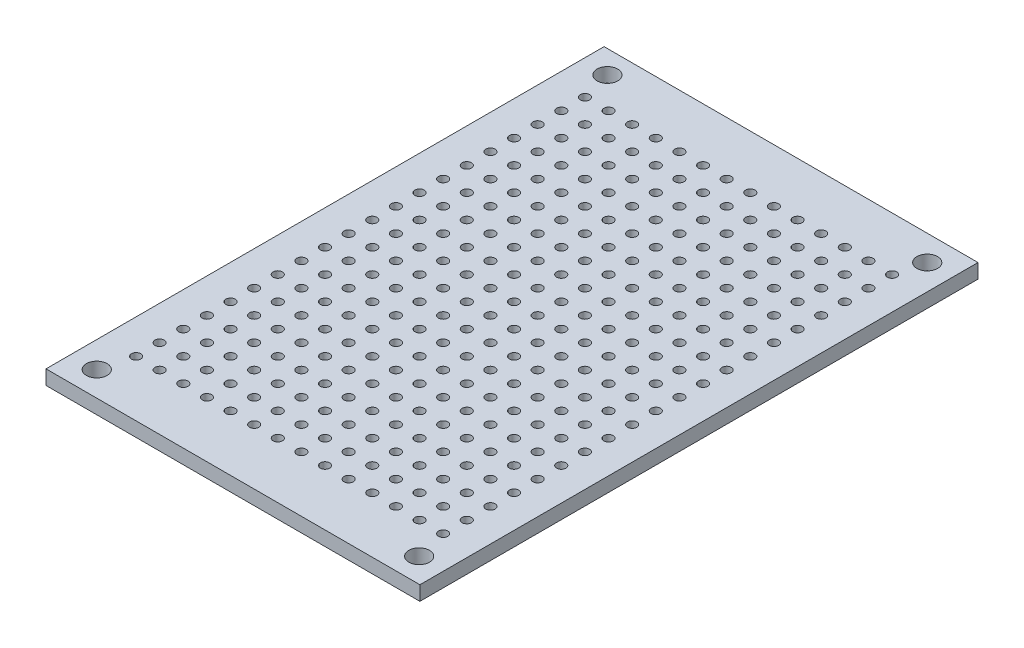
from build123d import *

# Parameters (mm, degrees)
SKETCH1_W            = 40.2
SKETCH1_H            = 60
SKETCH1_R            = 1.11
BOSS_EXTRUDE1_DEPTH  = 1.55
SKETCH2_R            = 0.5
CUT_EXTRUDE1_DEPTH   = 1.55
LPATTERN1_COUNT      = 14
LPATTERN1_PITCH      = 2.54
LPATTERN1_COUNT_DIR2 = 20
LPATTERN1_PITCH_DIR2 = 2.54


with BuildPart() as part:
    # Sketch1 → Boss-Extrude1 (new body)
    with BuildSketch(Plane(origin=(0, 0, 0), x_dir=(1, 0, 0), z_dir=(0, 1, 0))):
        Rectangle(SKETCH1_W, SKETCH1_H)
        with Locations((-17.28, 27.54)):
            Circle(SKETCH1_R, mode=Mode.SUBTRACT)
        with Locations((17.37, 27.27)):
            Circle(SKETCH1_R, mode=Mode.SUBTRACT)
        with Locations((17.408419603, -27.39)):
            Circle(SKETCH1_R, mode=Mode.SUBTRACT)
        with Locations((-17.30410214, -27.34)):
            Circle(SKETCH1_R, mode=Mode.SUBTRACT)
    extrude(amount=BOSS_EXTRUDE1_DEPTH)

    # Sketch2 → Cut-Extrude1 (cut)
    with BuildSketch(Plane(origin=(0, 1.55, 0), x_dir=(1, 0, 0), z_dir=(0, 1, 0))):
        with Locations((16.6, -24)):
            Circle(SKETCH2_R)
    cut_extrude1 = extrude(amount=-CUT_EXTRUDE1_DEPTH, mode=Mode.SUBTRACT)

    # LPattern1: Cut-Extrude1 14 × 20
    with Locations(*[(-i * LPATTERN1_PITCH, 0, -j * LPATTERN1_PITCH_DIR2) for i in range(LPATTERN1_COUNT) for j in range(LPATTERN1_COUNT_DIR2) if (i, j) != (0, 0)]):
        add(cut_extrude1, mode=Mode.SUBTRACT)


solid = part.part
